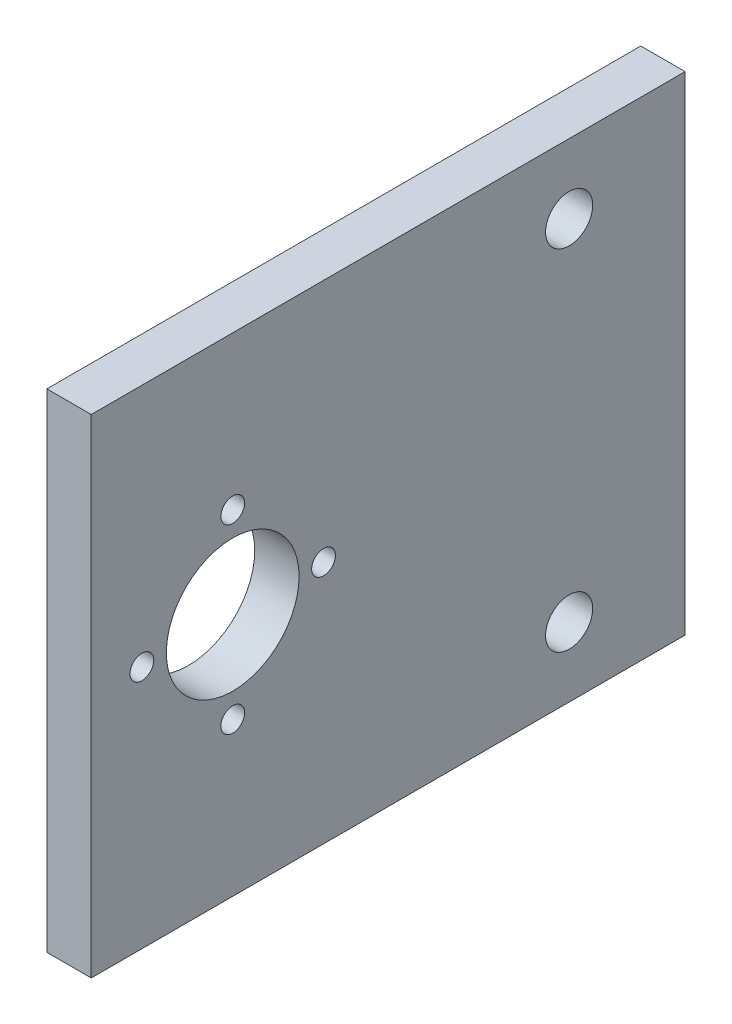
from build123d import *

# Parameters (mm, degrees)
SKETCH1_W           = 69.85
SKETCH1_H           = 85
SKETCH1_R           = 1.7
SKETCH1_R_2         = 9.5
SKETCH1_R_3         = 3.37312
BOSS_EXTRUDE1_DEPTH = 6.35


with BuildPart() as part:
    # Sketch1 → Boss-Extrude1 (new body)
    with BuildSketch(Plane.YZ):
        Rectangle(SKETCH1_W, SKETCH1_H)
        with Locations((0, 35.25)):
            Circle(SKETCH1_R, mode=Mode.SUBTRACT)
        with Locations((0, 9.25)):
            Circle(SKETCH1_R, mode=Mode.SUBTRACT)
        with Locations((-13, 22.25)):
            Circle(SKETCH1_R, mode=Mode.SUBTRACT)
        with Locations((13, 22.25)):
            Circle(SKETCH1_R, mode=Mode.SUBTRACT)
        with Locations((0, 22.25)):
            Circle(SKETCH1_R_2, mode=Mode.SUBTRACT)
        with Locations((-25, -25.9)):
            Circle(SKETCH1_R_3, mode=Mode.SUBTRACT)
        with Locations((25, -25.9)):
            Circle(SKETCH1_R_3, mode=Mode.SUBTRACT)
    extrude(amount=BOSS_EXTRUDE1_DEPTH)


solid = part.part
